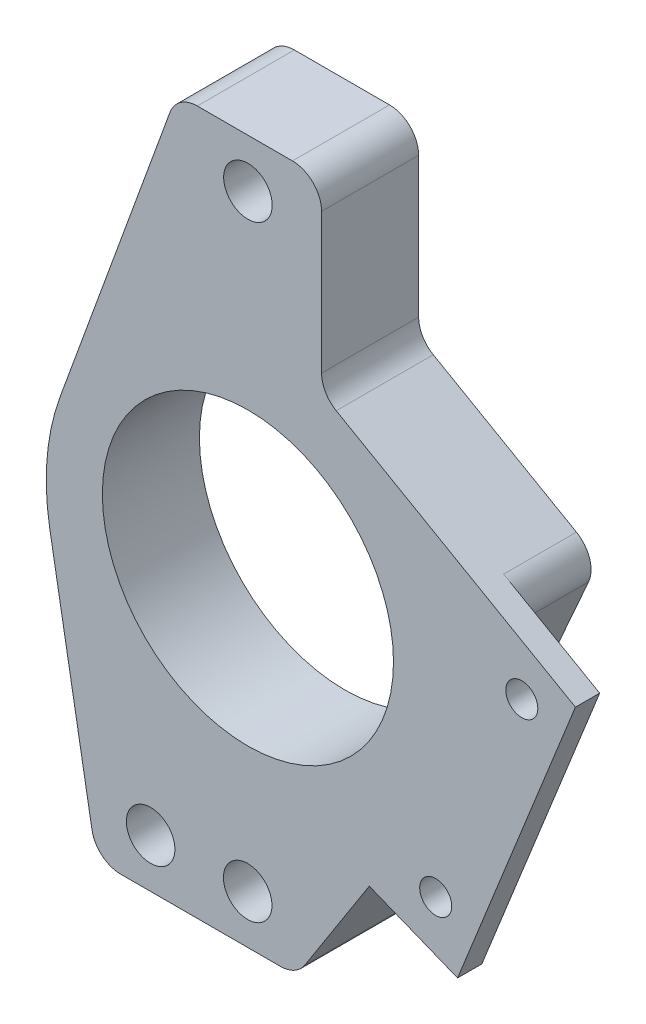
from build123d import *

# Parameters (mm, degrees)
SKETCH1_R           = 38.1
SKETCH1_R_2         = 6.35
BOSS_EXTRUDE1_DEPTH = 25.4
CUT_EXTRUDE1_DEPTH  = 19.05
SKETCH3_R           = 4.191
CUT_EXTRUDE2_DEPTH  = 135.408969451
FILLET1_R           = 7.62


with BuildPart() as part:
    # Sketch1 → Boss-Extrude1 (new body)
    with BuildSketch(Plane.XY):
        with BuildLine():
            Line((-18.576252895, 100.365223368), (19.281255226, 100.365223368))
            Line((19.281255226, 100.365223368), (19.281255226, 51.662487547))
            Line((19.281255226, 51.662487547), (85.717168685, 13.57632424))
            Line((85.717168685, 13.57632424), (54.8677317, -63.233808937))
            Line((54.8677317, -63.233808937), (31.764899533, -53.954963352))
            Line((31.764899533, -53.954963352), (12.667818141, -83.786038719))
            Line((12.667818141, -83.786038719), (-39.703691579, -83.786038719))
            Line((-39.703691579, -83.786038719), (-51.867045524, -14.691351221))
            ThreePointArc((-51.867045524, -14.691351221), (-52.552830667, 1.14672743), (-49.113541671, 16.622073237))
            Line((-49.113541671, 16.622073237), (-18.576252895, 100.365223368))
        make_face()
        Circle(SKETCH1_R, mode=Mode.SUBTRACT)
        with Locations((0, 87.665223368)):
            Circle(SKETCH1_R_2, mode=Mode.SUBTRACT)
        with Locations((-0.06167368, -71.086038719)):
            Circle(SKETCH1_R_2, mode=Mode.SUBTRACT)
        with Locations((-25.46167368, -71.075181752)):
            Circle(SKETCH1_R_2, mode=Mode.SUBTRACT)
    extrude(amount=BOSS_EXTRUDE1_DEPTH)

    # Sketch2 → Cut-Extrude1 (cut)
    with BuildSketch(Plane.XY):
        Polygon((54.8677317, -63.233808937), (85.717168685, 13.57632424), (66.538177491, 24.571193621), (31.764899533, -53.954963352), align=None)
    extrude(amount=CUT_EXTRUDE1_DEPTH, mode=Mode.SUBTRACT)

    # Sketch3 → Cut-Extrude2 (cut, through all)
    with BuildSketch(Plane.XY.offset(25.4)):
        with Locations((71.679164996, 8.361848351)):
            Circle(SKETCH3_R)
        with Locations((49.148937242, -47.734792738)):
            Circle(SKETCH3_R)
    extrude(amount=-CUT_EXTRUDE2_DEPTH, mode=Mode.SUBTRACT)

    # Fillet1
    fillet1_edges = [part.edges().sort_by_distance(p)[0] for p in [
        (-18.576252895, 100.365223368, 12.7),
        (19.281255226, 100.365223368, 12.7),
        (19.281255226, 51.662487547, 12.7),
        (66.538177491, 24.571193621, 9.525),
        (12.667818141, -83.786038719, 12.7),
        (-39.703691579, -83.786038719, 12.7),
    ]]
    fillet(fillet1_edges, radius=FILLET1_R)


solid = part.part
